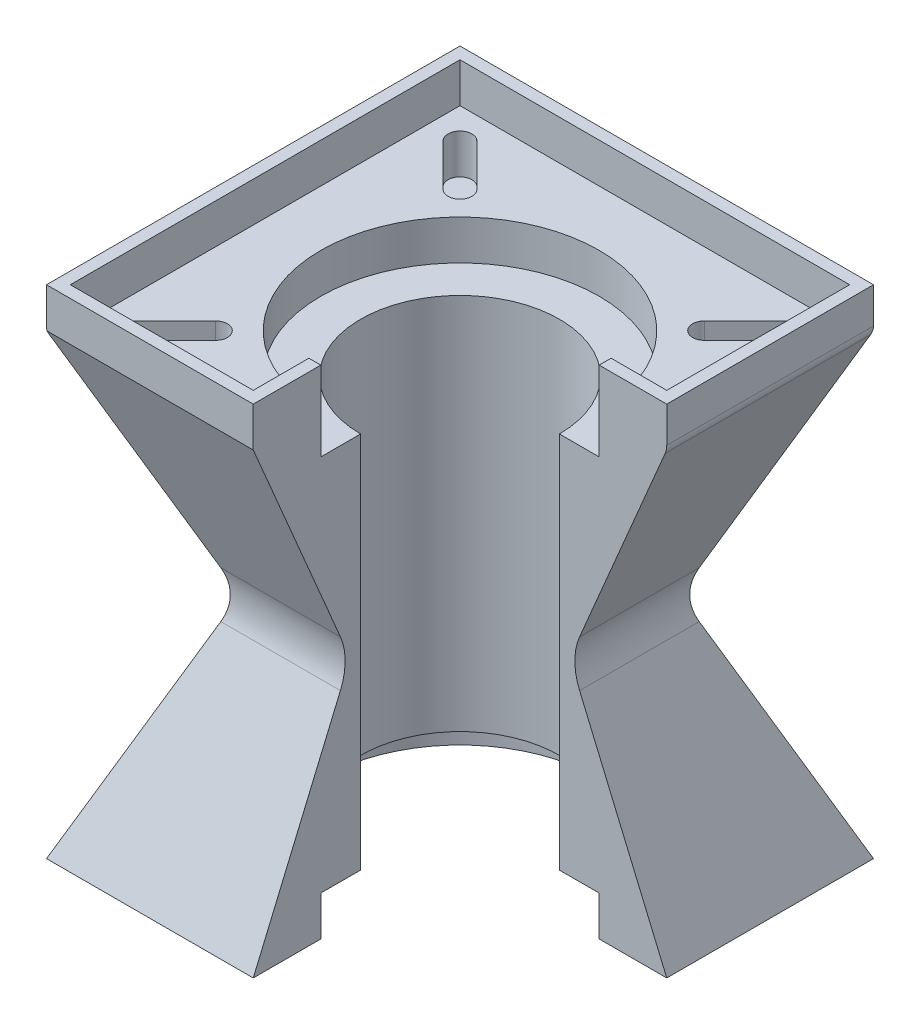
from build123d import *

# Parameters (mm, degrees)
SKETCH1_W           = 104
SKETCH1_H           = 104
BOSS_EXTRUDE1_DEPTH = 57.5
BOSS_EXTRUDE1_TAPER = 23
SKETCH2_R           = 25
CUT_EXTRUDE1_DEPTH  = 187.700294763
FILLET1_R           = 15
SKETCH3_R           = 35
CUT_EXTRUDE2_DEPTH  = 10
CUT_EXTRUDE3_START  = -10
SKETCH5_R           = 35
CUT_EXTRUDE3_DEPTH  = 10
SKETCH6_W           = 52
SKETCH6_H           = 52
CUT_EXTRUDE4_DEPTH  = 187.700294763
BOSS_EXTRUDE2_DEPTH = 10
FILLET2_R           = 5
CUT_EXTRUDE5_DEPTH  = 10


with BuildPart() as part:
    # Sketch1 → Boss-Extrude1 (new body)
    with BuildSketch(Plane(origin=(0, 0, 0), x_dir=(1, 0, 0), z_dir=(0, 1, 0))):
        with Locations((52, 52)):
            Rectangle(SKETCH1_W, SKETCH1_H)
    extrude(amount=BOSS_EXTRUDE1_DEPTH, taper=BOSS_EXTRUDE1_TAPER)

    # Mirror1: part across plane


with BuildPart() as part_1:
    add(part.part)
    add(part.part.mirror(Plane(origin=(0, 57.5, 0), x_dir=(0, 0, 1), z_dir=(0, -1, 0))))

    # Sketch2 → Cut-Extrude1 (cut, through all)
    with BuildSketch(Plane(origin=(0, 115, 0), x_dir=(1, 0, 0), z_dir=(0, 1, 0))):
        with Locations(Location((52, 52, 0), (0, 0, 270))):
            Circle(SKETCH2_R)
    extrude(amount=-CUT_EXTRUDE1_DEPTH, mode=Mode.SUBTRACT)

    # Fillet1
    # the kernel refuses this fillet: 15 mm, written as the material it adds along each edge
    with BuildSketch(Plane(origin=(24.407301932, 57.5, -95.510503676), x_dir=(-0.39073112848927455, -0.9205048534524399, 0), z_dir=(0, 0, 1))) as fillet1_piece_1_section:
        with BuildLine():
            CenterArc((FILLET1_R * 0.42447481621, -FILLET1_R), FILLET1_R, 90, 46)
            Line((-FILLET1_R * 0.294864984129, -FILLET1_R * 0.305341629541), (0, 0))
            Line((0, 0), (FILLET1_R * 0.42447481621, 0))
        make_face()
    fillet1_piece_1 = extrude(amount=87.021007352, mode=Mode.PRIVATE)
    fillet1_piece_1 = fillet1_piece_1 - Plane(origin=(24.407301932, 57.5, -8.111896271), x_dir=(0, -0.39073112848927466, -0.9205048534524399), z_dir=(-1, 0, 0)) * Cylinder(15, 200, mode=Mode.PRIVATE)
    fillet1_piece_1 = fillet1_piece_1 - Plane(origin=(24.407301932, 57.5, -95.888103729), x_dir=(0, -0.3907311284892748, 0.9205048534524398), z_dir=(1, 0, 0)) * Cylinder(15, 200, mode=Mode.PRIVATE)
    add(fillet1_piece_1)
    with BuildSketch(Plane(origin=(8.489496324, 57.5, -24.407301932), x_dir=(0, -0.9205048534524399, 0.39073112848927455), z_dir=(1, 0, 0))) as fillet1_piece_2_section:
        with BuildLine():
            CenterArc((FILLET1_R * 0.42447481621, -FILLET1_R), FILLET1_R, 90, 46)
            Line((-FILLET1_R * 0.294864984129, -FILLET1_R * 0.305341629541), (0, 0))
            Line((0, 0), (FILLET1_R * 0.42447481621, 0))
        make_face()
    fillet1_piece_2 = extrude(amount=87.021007352, mode=Mode.PRIVATE)
    fillet1_piece_2 = fillet1_piece_2 - Plane(origin=(95.888103729, 57.5, -24.407301932), x_dir=(-0.9205048534524398, -0.3907311284892748, 0), z_dir=(0, 0, 1)) * Cylinder(15, 200, mode=Mode.PRIVATE)
    fillet1_piece_2 = fillet1_piece_2 - Plane(origin=(8.111896271, 57.5, -24.407301932), x_dir=(0.9205048534524399, -0.39073112848927466, 0), z_dir=(0, 0, -1)) * Cylinder(15, 200, mode=Mode.PRIVATE)
    add(fillet1_piece_2)
    with BuildSketch(Plane(origin=(79.592698068, 57.5, -8.489496324), x_dir=(0.39073112848927455, -0.9205048534524399, 0), z_dir=(0, 0, -1))) as fillet1_piece_3_section:
        with BuildLine():
            CenterArc((FILLET1_R * 0.42447481621, -FILLET1_R), FILLET1_R, 90, 46)
            Line((-FILLET1_R * 0.294864984129, -FILLET1_R * 0.305341629541), (0, 0))
            Line((0, 0), (FILLET1_R * 0.42447481621, 0))
        make_face()
    fillet1_piece_3 = extrude(amount=87.021007352, mode=Mode.PRIVATE)
    fillet1_piece_3 = fillet1_piece_3 - Plane(origin=(79.592698068, 57.5, -8.111896271), x_dir=(0, -0.39073112848927466, -0.9205048534524399), z_dir=(-1, 0, 0)) * Cylinder(15, 200, mode=Mode.PRIVATE)
    fillet1_piece_3 = fillet1_piece_3 - Plane(origin=(79.592698068, 57.5, -95.888103729), x_dir=(0, -0.3907311284892748, 0.9205048534524398), z_dir=(1, 0, 0)) * Cylinder(15, 200, mode=Mode.PRIVATE)
    add(fillet1_piece_3)
    with BuildSketch(Plane(origin=(95.510503676, 57.5, -79.592698068), x_dir=(0, -0.9205048534524399, -0.39073112848927455), z_dir=(-1, 0, 0))) as fillet1_piece_4_section:
        with BuildLine():
            CenterArc((FILLET1_R * 0.42447481621, -FILLET1_R), FILLET1_R, 90, 46)
            Line((-FILLET1_R * 0.294864984129, -FILLET1_R * 0.305341629541), (0, 0))
            Line((0, 0), (FILLET1_R * 0.42447481621, 0))
        make_face()
    fillet1_piece_4 = extrude(amount=87.021007352, mode=Mode.PRIVATE)
    fillet1_piece_4 = fillet1_piece_4 - Plane(origin=(95.888103729, 57.5, -79.592698068), x_dir=(-0.9205048534524398, -0.3907311284892748, 0), z_dir=(0, 0, 1)) * Cylinder(15, 200, mode=Mode.PRIVATE)
    fillet1_piece_4 = fillet1_piece_4 - Plane(origin=(8.111896271, 57.5, -79.592698068), x_dir=(0.9205048534524399, -0.39073112848927466, 0), z_dir=(0, 0, -1)) * Cylinder(15, 200, mode=Mode.PRIVATE)
    add(fillet1_piece_4)

    # Sketch3 → Cut-Extrude2 (cut)
    with BuildSketch(Plane(origin=(0, 115, 0), x_dir=(1, 0, 0), z_dir=(0, 1, 0))):
        with Locations(Location((52, 52, 0), (0, 0, 270))):
            Circle(SKETCH3_R)
    extrude(amount=-CUT_EXTRUDE2_DEPTH, mode=Mode.SUBTRACT)

    # Sketch5 → Cut-Extrude3 (cut)
    with BuildSketch(Plane.XZ.offset(CUT_EXTRUDE3_START)):
        with Locations(Location((52, -52, 0), (0, 0, 90))):
            Circle(SKETCH5_R)
    extrude(amount=CUT_EXTRUDE3_DEPTH, mode=Mode.SUBTRACT)

    # Sketch6 → Cut-Extrude4 (cut, through all)
    with BuildSketch(Plane(origin=(0, 115, 0), x_dir=(1, 0, 0), z_dir=(0, 1, 0))):
        with Locations((78, 26)):
            Rectangle(SKETCH6_W, SKETCH6_H)
    extrude(amount=-CUT_EXTRUDE4_DEPTH, mode=Mode.SUBTRACT)

    # Sketch7 → Boss-Extrude2 (add)
    with BuildSketch(Plane(origin=(0, 115, 0), x_dir=(1, 0, 0), z_dir=(0, 1, 0))):
        Polygon((52, 17), (52, 0), (0, 0), (0, 104), (104, 104), (104, 52), (87, 52), (87, 55), (101, 55), (101, 101), (3, 101), (3, 3), (49, 3), (49, 17), align=None)
    extrude(amount=BOSS_EXTRUDE2_DEPTH)

    # Fillet2
    fillet2_edges = [part_1.edges().sort_by_distance(p)[0] for p in [
        (26, 115, -3),
        (0, 115, -52),
        (52, 115, -104),
        (104, 115, -78),
    ]]
    fillet(fillet2_edges, radius=FILLET2_R)

    # Sketch8 → Cut-Extrude5 (cut)
    with BuildSketch(Plane(origin=(0, 115, 0), x_dir=(1, 0, 0), z_dir=(0, 1, 0))):
        with BuildLine():
            Line((12.760046787, 95.4825939), (23.366648505, 84.875992182))
            ThreePointArc((23.366648505, 84.875992182), (23.366648505, 80.633351495), (19.124007818, 80.633351495))
            Line((19.124007818, 80.633351495), (8.5174061, 91.239953213))
            ThreePointArc((8.5174061, 91.239953213), (8.5174061, 95.4825939), (12.760046787, 95.4825939))
        make_face()
        with BuildLine():
            Line((12.760046787, 8.5174061), (23.366648505, 19.124007818))
            ThreePointArc((23.366648505, 19.124007818), (23.366648505, 23.366648505), (19.124007818, 23.366648505))
            Line((19.124007818, 23.366648505), (8.5174061, 12.760046787))
            ThreePointArc((8.5174061, 12.760046787), (8.5174061, 8.5174061), (12.760046787, 8.5174061))
        make_face()
        with BuildLine():
            Line((91.239953213, 95.4825939), (80.633351495, 84.875992182))
            ThreePointArc((80.633351495, 84.875992182), (80.633351495, 80.633351495), (84.875992182, 80.633351495))
            Line((84.875992182, 80.633351495), (95.4825939, 91.239953213))
            ThreePointArc((95.4825939, 91.239953213), (95.4825939, 95.4825939), (91.239953213, 95.4825939))
        make_face()
    extrude(amount=-CUT_EXTRUDE5_DEPTH, mode=Mode.SUBTRACT)


solid = part_1.part
